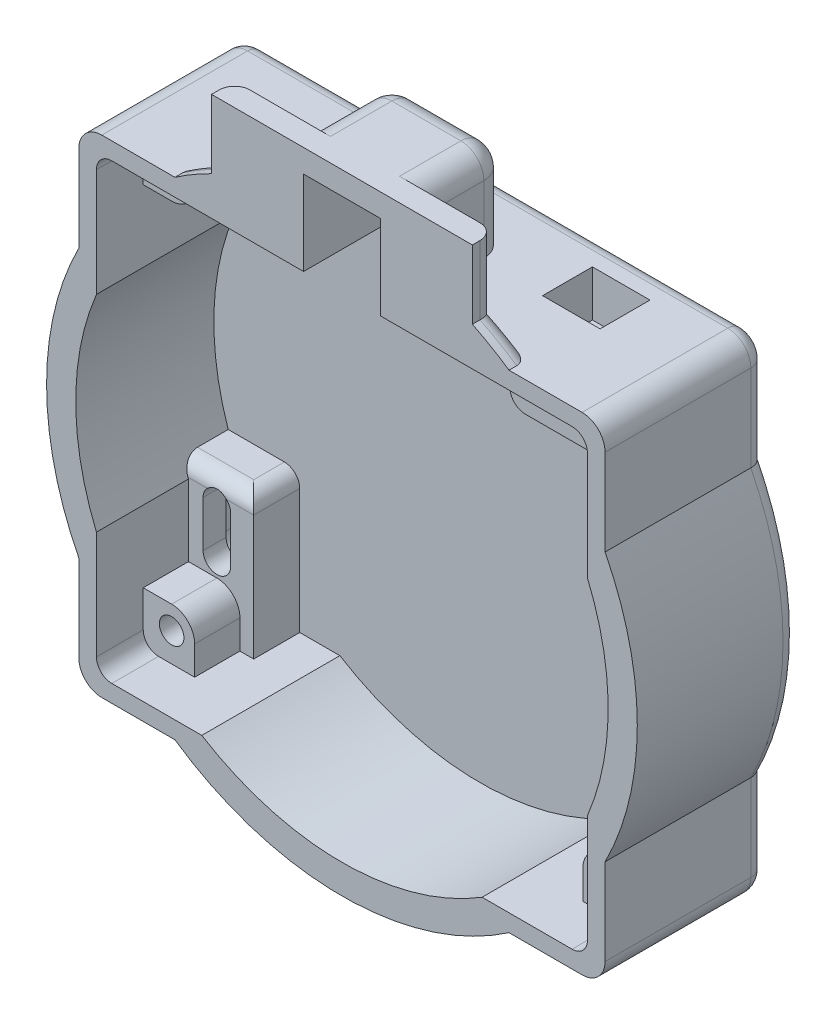
from build123d import *

# Parameters (mm, degrees)
SKETCH1_R               = 1.6
BOSS_EXTRUDE5_DEPTH     = 3
SKETCH1_8_R             = 1.6
BOSS_EXTRUDE6_DEPTH     = 21
SKETCH4_W               = 43.551693422
SKETCH4_H               = 11.75
CUT_EXTRUDE3_DEPTH      = 7
CUT_EXTRUDE5_START      = -11.75
SKETCH6_W               = 7.5
SKETCH6_H               = 6
SKETCH6_W_2             = 3.5
SKETCH6_W_3             = 31
SKETCH6_H_2             = 11
CUT_EXTRUDE5_DEPTH      = 11.75
SKETCH6_4_W             = 7.5
SKETCH6_4_H             = 6
SKETCH6_4_W_2           = 3.5
CUT_EXTRUDE6_DEPTH      = 40
CUT_EXTRUDE7_DEPTH      = 5
CUT_EXTRUDE7_DEPTH_BACK = 5
SKETCH8_W               = 11
SKETCH8_H               = 16
SKETCH9_W               = 64
SKETCH9_H               = 59
CUT_EXTRUDE8_DEPTH      = 6.1
CUT_EXTRUDE11_DEPTH     = 11.9
BOSS_EXTRUDE8_START     = -3
SKETCH13_W              = 6.5
SKETCH13_H              = 11.5
BOSS_EXTRUDE8_DEPTH     = 6
CUT_EXTRUDE12_DEPTH     = 62.769733689
SKETCH13_6_W            = 6.5
SKETCH13_6_H            = 11.5
CUT_EXTRUDE13_DEPTH     = 6
SKETCH15_W              = 12
SKETCH15_H              = 12.4
BOSS_EXTRUDE10_DEPTH    = 12.5
CUT_EXTRUDE14_DEPTH     = 6
CUT_EXTRUDE15_REACH     = 84.815
SKETCH15_4_W            = 2.9
SKETCH15_4_H            = 5.8
SKETCH1_9_R             = 1.6
CUT_EXTRUDE16_DEPTH     = 62.769733689
FILLET1_R               = 3
FILLET3_R               = 2
FILLET6_R               = 2
FILLET7_R               = 2


with BuildPart() as part:
    # Sketch1 → Boss-Extrude5 (new body)
    with BuildSketch(Plane.XY):
        with BuildLine():
            Line((17, 43.5), (-17, 43.5))
            Line((-17, 43.5), (-17, 34.543450899))
            ThreePointArc((-17, 34.543450899), (-19.438168999, 33.232628334), (-21.775846711, 31.75))
            Line((-21.775846711, 31.75), (-34.3, 31.75))
            Line((-34.3, 31.75), (-34.3, 17.485994396))
            ThreePointArc((-34.3, 17.485994396), (-38.5, 0), (-34.3, -17.485994396))
            Line((-34.3, -17.485994396), (-34.3, -31.75))
            Line((-34.3, -31.75), (-21.775846711, -31.75))
            ThreePointArc((-21.775846711, -31.75), (0, -38.5), (21.775846711, -31.75))
            Line((21.775846711, -31.75), (34.3, -31.75))
            Line((34.3, -31.75), (34.3, -17.485994396))
            ThreePointArc((34.3, -17.485994396), (38.5, 0), (34.3, 17.485994396))
            Line((34.3, 17.485994396), (34.3, 31.75))
            Line((34.3, 31.75), (21.775846711, 31.75))
            ThreePointArc((21.775846711, 31.75), (19.438168999, 33.232628334), (17, 34.543450899))
            Line((17, 34.543450899), (17, 43.5))
        make_face()
        with Locations((-28.3, 25.75)):
            Circle(SKETCH1_R, mode=Mode.SUBTRACT)
        with Locations((28.3, 25.75)):
            Circle(SKETCH1_R, mode=Mode.SUBTRACT)
        with Locations((28.3, -25.75)):
            Circle(SKETCH1_R, mode=Mode.SUBTRACT)
    extrude(amount=BOSS_EXTRUDE5_DEPTH)

    # Sketch1<8> → Boss-Extrude6 (add)
    with BuildSketch(Plane.XY):
        with BuildLine():
            Line((17, 43.5), (-17, 43.5))
            Line((-17, 43.5), (-17, 34.543450899))
            ThreePointArc((-17, 34.543450899), (-19.438168999, 33.232628334), (-21.775846711, 31.75))
            Line((-21.775846711, 31.75), (-34.3, 31.75))
            Line((-34.3, 31.75), (-34.3, 17.485994396))
            ThreePointArc((-34.3, 17.485994396), (-38.5, 0), (-34.3, -17.485994396))
            Line((-34.3, -17.485994396), (-34.3, -31.75))
            Line((-34.3, -31.75), (-21.775846711, -31.75))
            ThreePointArc((-21.775846711, -31.75), (0, -38.5), (21.775846711, -31.75))
            Line((21.775846711, -31.75), (34.3, -31.75))
            Line((34.3, -31.75), (34.3, -17.485994396))
            ThreePointArc((34.3, -17.485994396), (38.5, 0), (34.3, 17.485994396))
            Line((34.3, 17.485994396), (34.3, 31.75))
            Line((34.3, 31.75), (21.775846711, 31.75))
            ThreePointArc((21.775846711, 31.75), (19.438168999, 33.232628334), (17, 34.543450899))
            Line((17, 34.543450899), (17, 43.5))
        make_face()
        with BuildLine():
            ThreePointArc((18.271288953, 29.5), (0, -34.7), (-18.271288953, 29.5))
            Line((-18.271288953, 29.5), (18.271288953, 29.5))
        make_face(mode=Mode.SUBTRACT)
        with Locations((-28.3, 25.75)):
            Circle(SKETCH1_8_R, mode=Mode.SUBTRACT)
        with Locations((28.3, 25.75)):
            Circle(SKETCH1_8_R, mode=Mode.SUBTRACT)
        with Locations((28.3, -25.75)):
            Circle(SKETCH1_8_R, mode=Mode.SUBTRACT)
    extrude(amount=BOSS_EXTRUDE6_DEPTH)

    # Sketch4 → Cut-Extrude3 (cut)
    with BuildSketch(Plane(origin=(0, 0, 0), x_dir=(-1, 0, 0), z_dir=(0, 0, -1))):
        with Locations((0, 37.625)):
            Rectangle(SKETCH4_W, SKETCH4_H)
    extrude(amount=-CUT_EXTRUDE3_DEPTH, mode=Mode.SUBTRACT)

    # Sketch6 → Cut-Extrude5 (cut)
    with BuildSketch(Plane(origin=(0, 43.5, 0), x_dir=(1, 0, 0), z_dir=(0, 1, 0)).offset(CUT_EXTRUDE5_START)):
        with Locations((-13.25, -12.5)):
            Rectangle(SKETCH6_W, SKETCH6_H)
        with Locations((-18.75, -12.5)):
            Rectangle(SKETCH6_W_2, SKETCH6_H)
        Polygon((-17, -7), (-17, -9.5), (-9.5, -9.5), (-9.5, -15.5), (-17, -15.5), (-17, -18), (-7.5, -18), (-7.5, -7), align=None)
        Polygon((-20.5, -15.5), (-20.5, -9.5), (-17, -9.5), (-17, -7), (-38.5, -7), (-38.5, -18), (-17, -18), (-17, -15.5), align=None)
        with Locations((23, -12.5)):
            Rectangle(SKETCH6_W_3, SKETCH6_H_2)
    extrude(amount=CUT_EXTRUDE5_DEPTH, mode=Mode.SUBTRACT)

    # Sketch6<4> → Cut-Extrude6 (cut)
    with BuildSketch(Plane(origin=(0, 43.5, 0), x_dir=(1, 0, 0), z_dir=(0, 1, 0))):
        with Locations((-13.25, -12.5)):
            Rectangle(SKETCH6_4_W, SKETCH6_4_H)
        with Locations((-18.75, -12.5)):
            Rectangle(SKETCH6_4_W_2, SKETCH6_4_H)
    extrude(amount=-CUT_EXTRUDE6_DEPTH, mode=Mode.SUBTRACT)

    # Sketch8 → Cut-Extrude7 (cut, two sides: drawn at the far end of the back side and taken through both)
    with BuildSketch(Plane(origin=(0, 0, 0), x_dir=(0, 0, -1), z_dir=(1, 0, 0)).offset(-CUT_EXTRUDE7_DEPTH_BACK)):
        with Locations((-15.5, 32.5)):
            Rectangle(SKETCH8_W, SKETCH8_H)
    extrude(amount=CUT_EXTRUDE7_DEPTH + CUT_EXTRUDE7_DEPTH_BACK, mode=Mode.SUBTRACT)

    # Sketch9 → Cut-Extrude8 (cut)
    with BuildSketch(Plane.XY.offset(21)):
        Rectangle(SKETCH9_W, SKETCH9_H)
    extrude(amount=-CUT_EXTRUDE8_DEPTH, mode=Mode.SUBTRACT)

    # Sketch12 → Cut-Extrude11 (cut)
    with BuildSketch(Plane.XY.offset(14.9)):
        with BuildLine():
            Line((-25.3, 29.5), (-18, 29.5))
            Line((-18, 29.5), (-18, 11.5))
            Line((-18, 11.5), (-32, 11.5))
            Line((-32, 11.5), (-32, 22.75))
            Line((-32, 22.75), (-28.3, 22.75))
            ThreePointArc((-28.3, 22.75), (-26.178679656, 23.628679656), (-25.3, 25.75))
            Line((-25.3, 25.75), (-25.3, 29.5))
        make_face()
        with BuildLine():
            Line((28.3, 22.75), (32, 22.75))
            Line((32, 22.75), (32, 11.5))
            Line((32, 11.5), (18, 11.5))
            Line((18, 11.5), (18, 29.5))
            Line((18, 29.5), (25.3, 29.5))
            Line((25.3, 29.5), (25.3, 25.75))
            ThreePointArc((25.3, 25.75), (26.178679656, 23.628679656), (28.3, 22.75))
        make_face()
        with BuildLine():
            Line((-28.3, -22.75), (-32, -22.75))
            Line((-32, -22.75), (-32, -11.5))
            Line((-32, -11.5), (-18, -11.5))
            Line((-18, -11.5), (-18, -29.5))
            Line((-18, -29.5), (-25.3, -29.5))
            Line((-25.3, -29.5), (-25.3, -25.75))
            ThreePointArc((-25.3, -25.75), (-26.178679656, -23.628679656), (-28.3, -22.75))
        make_face()
        with BuildLine():
            Line((28.3, -22.75), (32, -22.75))
            Line((32, -22.75), (32, -11.5))
            Line((32, -11.5), (18, -11.5))
            Line((18, -11.5), (18, -29.5))
            Line((18, -29.5), (25.3, -29.5))
            Line((25.3, -29.5), (25.3, -25.75))
            ThreePointArc((25.3, -25.75), (26.178679656, -23.628679656), (28.3, -22.75))
        make_face()
    extrude(amount=-CUT_EXTRUDE11_DEPTH, mode=Mode.SUBTRACT)

    # Sketch13 → Boss-Extrude8 (add)
    # profile 1 of 3: a face of its own
    with BuildSketch(Plane(origin=(0, 0, 0), x_dir=(-1, 0, 0), z_dir=(0, 0, -1)).offset(BOSS_EXTRUDE8_START)):
        with BuildLine():
            Line((23.5, -31.75), (34.3, -31.75))
            Line((34.3, -31.75), (34.3, -17.485994396))
            ThreePointArc((34.3, -17.485994396), (35.696267067, -14.4231244), (36.819661867, -11.25))
            Line((36.819661867, -11.25), (23.5, -11.25))
            Line((23.5, -11.25), (23.5, -31.75))
        make_face()
        with Locations((28.3, -17.55)):
            Rectangle(SKETCH13_W, SKETCH13_H, mode=Mode.SUBTRACT)
    # profile 2 of 3: a face of its own
    with BuildSketch(Plane(origin=(0, 0, 0), x_dir=(-1, 0, 0), z_dir=(0, 0, -1)).offset(BOSS_EXTRUDE8_START)):
        with Locations((28.3, -17.55)):
            Rectangle(SKETCH13_W, SKETCH13_H)
        with BuildLine():
            ThreePointArc((30.1, -14.55), (28.3, -12.75), (26.5, -14.55))
            Line((26.5, -14.55), (26.5, -20.55))
            ThreePointArc((26.5, -20.55), (28.3, -22.35), (30.1, -20.55))
            Line((30.1, -20.55), (30.1, -14.55))
        make_face(mode=Mode.SUBTRACT)
    # profile 3 of 3: a face of its own
    with BuildSketch(Plane(origin=(0, 0, 0), x_dir=(-1, 0, 0), z_dir=(0, 0, -1)).offset(BOSS_EXTRUDE8_START)):
        with BuildLine():
            Line((30.1, -20.55), (30.1, -14.55))
            ThreePointArc((30.1, -14.55), (28.3, -12.75), (26.5, -14.55))
            Line((26.5, -14.55), (26.5, -20.55))
            ThreePointArc((26.5, -20.55), (28.3, -22.35), (30.1, -20.55))
        make_face()
    extrude(amount=-BOSS_EXTRUDE8_DEPTH)

    # Sketch13<4> → Cut-Extrude12 (cut, through all)
    with BuildSketch(Plane(origin=(0, 0, 0), x_dir=(-1, 0, 0), z_dir=(0, 0, -1))):
        with BuildLine():
            Line((30.1, -20.55), (30.1, -14.55))
            ThreePointArc((30.1, -14.55), (28.3, -12.75), (26.5, -14.55))
            Line((26.5, -14.55), (26.5, -20.55))
            ThreePointArc((26.5, -20.55), (28.3, -22.35), (30.1, -20.55))
        make_face()
    extrude(amount=-CUT_EXTRUDE12_DEPTH, mode=Mode.SUBTRACT)

    # Sketch13<6> → Cut-Extrude13 (cut)
    with BuildSketch(Plane(origin=(0, 0, 0), x_dir=(-1, 0, 0), z_dir=(0, 0, -1))):
        with Locations((28.3, -17.55)):
            Rectangle(SKETCH13_6_W, SKETCH13_6_H)
        with BuildLine():
            ThreePointArc((30.1, -14.55), (28.3, -12.75), (26.5, -14.55))
            Line((26.5, -14.55), (26.5, -20.55))
            ThreePointArc((26.5, -20.55), (28.3, -22.35), (30.1, -20.55))
            Line((30.1, -20.55), (30.1, -14.55))
        make_face(mode=Mode.SUBTRACT)
    extrude(amount=-CUT_EXTRUDE13_DEPTH, mode=Mode.SUBTRACT)

    # Sketch15 → Boss-Extrude10 (add)
    with BuildSketch(Plane(origin=(0, 31.75, 0), x_dir=(1, 0, 0), z_dir=(0, 1, 0))):
        with Locations((19.3, -6.2)):
            Rectangle(SKETCH15_W, SKETCH15_H)
    extrude(amount=-BOSS_EXTRUDE10_DEPTH)

    # Sketch15<3> → Cut-Extrude14 (cut)
    with BuildSketch(Plane(origin=(0, 31.75, 0), x_dir=(1, 0, 0), z_dir=(0, 1, 0))):
        Polygon((16.4, -4.6), (19.3, -4.6), (19.3, -3.9), (15.55, -3.9), (15.55, -10.4), (16.4, -10.4), align=None)
        Polygon((19.3, -3.9), (19.3, -4.6), (22.2, -4.6), (22.2, -10.4), (23.05, -10.4), (23.05, -3.9), align=None)
    extrude(amount=-CUT_EXTRUDE14_DEPTH, mode=Mode.SUBTRACT)

    # Sketch15<4> → Cut-Extrude15 (cut, up to next)
    with BuildSketch(Plane(origin=(0, 31.75, 0), x_dir=(1, 0, 0), z_dir=(0, 1, 0)), mode=Mode.PRIVATE) as cut_extrude15_sk1:
        with Locations((20.75, -7.5)):
            Rectangle(SKETCH15_4_W, SKETCH15_4_H)
    cut_extrude15_tool1 = extrude(cut_extrude15_sk1.sketch, amount=-CUT_EXTRUDE15_REACH, mode=Mode.PRIVATE) & part.part
    # Sketch15<4> → Cut-Extrude15 (cut, up to next)
    with BuildSketch(Plane(origin=(0, 31.75, 0), x_dir=(1, 0, 0), z_dir=(0, 1, 0)), mode=Mode.PRIVATE) as cut_extrude15_sk2:
        with Locations((17.85, -7.5)):
            Rectangle(SKETCH15_4_W, SKETCH15_4_H)
    cut_extrude15_tool2 = extrude(cut_extrude15_sk2.sketch, amount=-CUT_EXTRUDE15_REACH, mode=Mode.PRIVATE) & part.part
    add(cut_extrude15_tool1.solids().sort_by_distance((20.75, 31.75, 7.5))[0], mode=Mode.SUBTRACT)
    add(cut_extrude15_tool2.solids().sort_by_distance((17.85, 31.75, 7.5))[0], mode=Mode.SUBTRACT)

    # Sketch1<9> → Cut-Extrude16 (cut, through all)
    with BuildSketch(Plane.XY):
        with Locations(Location((-28.3, -25.75, 0), (0, 0, 180))):
            Circle(SKETCH1_9_R)
    extrude(amount=CUT_EXTRUDE16_DEPTH, mode=Mode.SUBTRACT)

    # Fillet1
    fillet1_edges = [part.edges().sort_by_distance(p)[0] for p in [
        (0, 43.5, 7),
        (-7.5, 37.625, 7),
        (-7.5, 43.5, 12.5),
        (7.5, 37.625, 7),
        (7.5, 43.5, 12.5),
        (0, 29.5, 10),
        (0, 40.5, 10),
        (-34.3, 31.75, 10.5),
        (34.3, 31.75, 10.5),
        (34.3, -31.75, 10.5),
        (-34.3, -31.75, 10.5),
    ]]
    fillet(fillet1_edges, radius=FILLET1_R)

    # Fillet3
    fillet3_edges = [part.edges().sort_by_distance(p)[0] for p in [
        (-32, 29.5, 17.95),
        (-32, -29.5, 17.95),
        (32, 29.5, 17.95),
        (32, -29.5, 17.95),
    ]]
    fillet(fillet3_edges, radius=FILLET3_R)

    # Fillet6
    fillet6_edges = [part.edges().sort_by_distance(p)[0] for p in [
        (-19.438168999, 33.232628334, 18),
        (-17, 39.021725449, 18),
        (19.438168999, 33.232628334, 18),
        (17, 39.021725449, 18),
        (38.5, 0, 0),
        (0, -38.5, 0),
        (-38.5, 0, 0),
        (-26.537923356, -31.75, 0),
        (0, 31.75, 0),
        (34.3, 23.117997198, 0),
        (34.3, -23.117997198, 0),
        (26.537923356, -31.75, 0),
        (-34.3, -23.117997198, 0),
        (-34.3, 23.117997198, 0),
        (33.421320344, 30.871320344, 0),
        (33.421320344, -30.871320344, 0),
        (-33.421320344, 30.871320344, 0),
        (-33.421320344, -30.871320344, 0),
    ]]
    fillet(fillet6_edges, radius=FILLET6_R)

    # Fillet7
    # the kernel refuses this fillet: 2 mm, written as the material it adds along each edge
    with BuildSketch(Plane(origin=(-31.55, -11.8, 0), x_dir=(0, -1, 0), z_dir=(0, 0, 1)), Plane(origin=(-25.05, -11.8, 0), x_dir=(-1, 0, 0), z_dir=(0, 0, 1))) as fillet7_piece_1:
        with BuildLine():
            CenterArc((FILLET7_R, FILLET7_R), FILLET7_R, 180, 90)
            Line((0, FILLET7_R), (0, 0))
            Line((0, 0), (FILLET7_R, 0))
        make_face()
    extrude(amount=6)
    with BuildSketch(Plane(origin=(-31.55, -23.3, 0), x_dir=(0, 1, 0), z_dir=(0, 0, 1)), Plane(origin=(-25.05, -23.3, 0), x_dir=(-1, 0, 0), z_dir=(0, 0, 1))) as fillet7_piece_2:
        with BuildLine():
            CenterArc((FILLET7_R, -FILLET7_R), FILLET7_R, 90, 90)
            Line((0, -FILLET7_R), (0, 0))
            Line((0, 0), (FILLET7_R, 0))
        make_face()
    extrude(amount=6)
    # the kernel refuses this fillet: 2 mm, written as the material it takes off along each edge
    with BuildSketch(Plane(origin=(-23.5, -11.25, 3), x_dir=(-1, 0, 0), z_dir=(0, 0, 1))) as fillet7_2_piece_1:
        with BuildLine():
            CenterArc((FILLET7_R, FILLET7_R), FILLET7_R, 180, 90)
            Line((0, FILLET7_R), (0, 0))
            Line((0, 0), (FILLET7_R, 0))
        make_face()
    extrude(amount=11, mode=Mode.SUBTRACT)
    with BuildSketch(Plane(origin=(-37.825714006, -11.25, 9), x_dir=(0, -1, 0), z_dir=(1, 0, 0))) as fillet7_2_piece_2_section:
        with BuildLine():
            CenterArc((FILLET7_R, FILLET7_R), FILLET7_R, 180, 90)
            Line((0, FILLET7_R), (0, 0))
            Line((0, 0), (FILLET7_R, 0))
        make_face()
    fillet7_2_piece_2 = extrude(amount=19.325714006, mode=Mode.PRIVATE)
    fillet7_2_piece_2 = fillet7_2_piece_2 & Plane(origin=(0, 0, 8.549300703), x_dir=(0.5265501139161386, 0.85014409221902, 0), z_dir=(0, 0, -1)) * Cylinder(34.7, 47, mode=Mode.PRIVATE)
    add(fillet7_2_piece_2, mode=Mode.SUBTRACT)
    with BuildSketch(Plane(origin=(13.3, 19.25, 17.4), x_dir=(1, 0, 0), z_dir=(0, 0, -1)), Plane(origin=(25.3, 19.25, 3), x_dir=(-1, 0, 0), z_dir=(0, 0, 1))) as fillet7_2_piece_3:
        with BuildLine():
            CenterArc((FILLET7_R, -FILLET7_R), FILLET7_R, 90, 90)
            Line((0, -FILLET7_R), (0, 0))
            Line((0, 0), (FILLET7_R, 0))
        make_face()
    extrude(amount=14.4, mode=Mode.SUBTRACT)


solid = part.part
